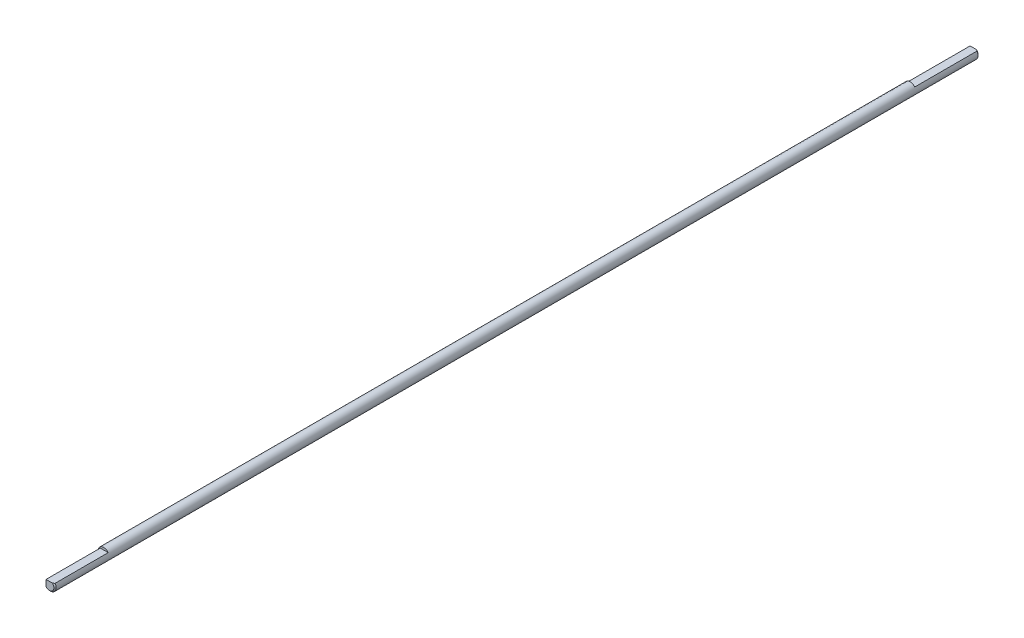
from build123d import *

# Parameters (mm, degrees)
SKETCH_1_R        = 2.5
BODY_DEPTH        = 408.5
CHAMFEREDGES_SIZE = 0.5
SKETCH2_W         = 28.630475487
SKETCH2_H         = 2.50986962
SKETCH2_W_2       = 28
SKETCH2_H_2       = 1.942146438
FIRSTSLOTS_DEPTH  = 409.515299591
CIRPATTERN1_COUNT = 2
CIRPATTERN1_ANGLE = 90


with BuildPart() as part:
    # Эскиз1 → Body (new body)
    with BuildSketch(Plane.XY):
        Circle(SKETCH_1_R)
    extrude(amount=BODY_DEPTH)

    # ChamferEdges
    chamferedges_edges = [part.edges().sort_by_distance(p)[0] for p in [
        (-2.5, 0, 408.5),
        (-2.5, 0, 0),
    ]]
    chamfer(chamferedges_edges, length=CHAMFEREDGES_SIZE)

    # Sketch2 → FirstSlots (cut, symmetric)
    with BuildSketch(Plane(origin=(0, 0, 0), x_dir=(0, 0, -1), z_dir=(1, 0, 0))):
        with Locations((-13.684762257, 2.75493481)):
            Rectangle(SKETCH2_W, SKETCH2_H)
        with Locations((-398.5, 2.471073219)):
            Rectangle(SKETCH2_W_2, SKETCH2_H_2)
    firstslots = extrude(amount=FIRSTSLOTS_DEPTH, both=True, mode=Mode.SUBTRACT)

    # CirPattern1: FirstSlots ×2 about axis
    cirpattern1_axis = Axis((0, 0, 408.5), (0, 0, 1))
    for i in range(1, CIRPATTERN1_COUNT):
        add(firstslots.rotate(cirpattern1_axis, i * CIRPATTERN1_ANGLE / (CIRPATTERN1_COUNT - 1)), mode=Mode.SUBTRACT)


solid = part.part
